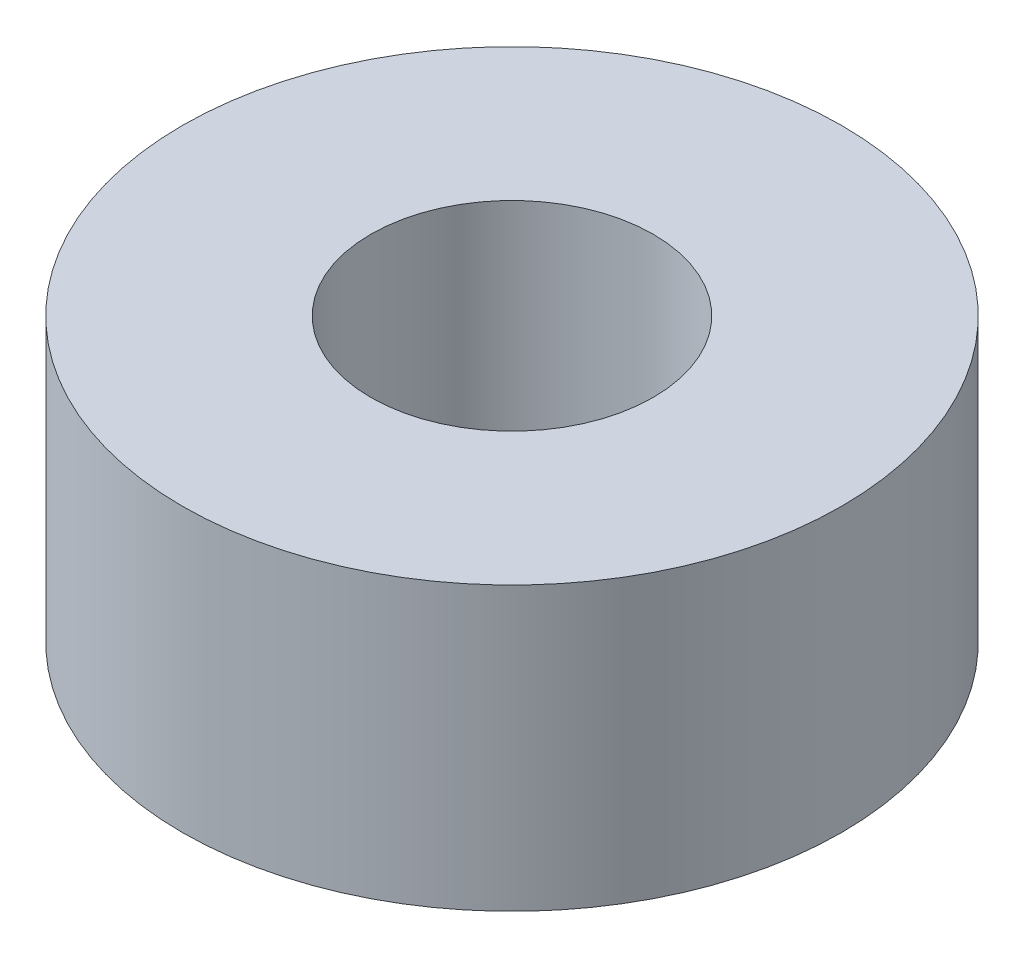
from build123d import *

# Parameters (mm, degrees)
BOSS_EXTRUDE1_DEPTH      = 1.5
BOSS_EXTRUDE1_DEPTH_BACK = 1.5
SKETCH1_R                = 3.5
SKETCH1_R_2              = 1.5


with BuildPart() as part:
    # Sketch1 → Boss-Extrude1 (new, two sides: drawn at the far end of the back side and taken through both)
    with BuildSketch(Plane(origin=(0, 0, 0), x_dir=(1, 0, 0), z_dir=(0, 1, 0)).offset(-BOSS_EXTRUDE1_DEPTH_BACK)):
        Circle(SKETCH1_R)
        Circle(SKETCH1_R_2, mode=Mode.SUBTRACT)
    extrude(amount=BOSS_EXTRUDE1_DEPTH + BOSS_EXTRUDE1_DEPTH_BACK)


solid = part.part
